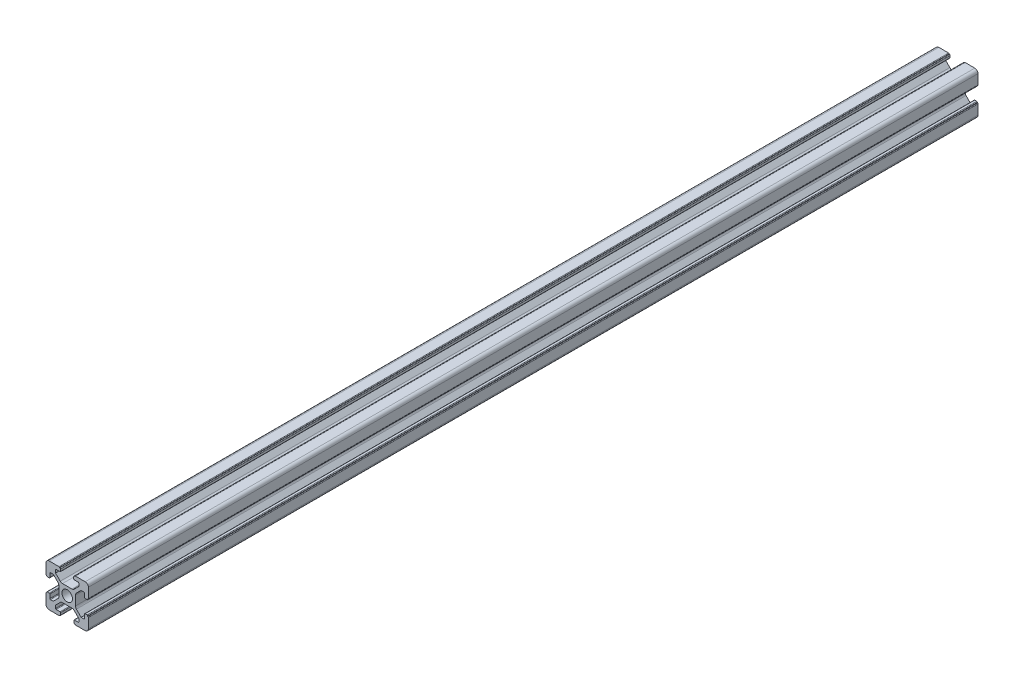
from build123d import *

# Parameters (mm, degrees)
BOSS_EXTRUDE1_DEPTH = 420
F_3DSKETCH2_R       = 2.5
CUT_EXTRUDE1_DEPTH  = 421.238108785


with BuildPart() as part:
    # Sketch1 → Boss-Extrude1 (new body)
    with BuildSketch(Plane.XY):
        with BuildLine():
            ThreePointArc((-4.339541497, 3.27832502), (-4.01438237, 2.791689997), (-3.900201668, 2.217664848))
            Line((-3.900201668, 2.217664848), (-3.900201668, -2.220777458))
            ThreePointArc((-3.900201668, -2.220777458), (-4.013982246, -2.793835668), (-4.338062619, -3.279956687))
            ThreePointArc((-4.338062619, -3.279956687), (-4.338801799, -3.280697416), (-4.339541497, -3.28143763))
            Line((-4.339541497, -3.28143763), (-6.559305445, -5.501201578))
            Line((-6.559305445, -5.501201578), (-7.918645273, -5.501201578))
            ThreePointArc((-7.918645273, -5.501201578), (-8.116635172, -5.419191476), (-8.198645273, -5.221201578))
            Line((-8.198645273, -5.221201578), (-8.198645273, -3.381201578))
            ThreePointArc((-8.198645273, -3.381201578), (-8.280655374, -3.183211679), (-8.478645273, -3.101201578))
            Line((-8.478645273, -3.101201578), (-9.418645273, -3.101201578))
            ThreePointArc((-9.418645273, -3.101201578), (-9.616635172, -3.183211679), (-9.698645273, -3.381201578))
            Line((-9.698645273, -3.381201578), (-9.698645273, -3.601201578))
            Line((-9.698645273, -3.601201578), (-9.718645273, -3.601201578))
            ThreePointArc((-9.718645273, -3.601201578), (-9.916635172, -3.683211679), (-9.998645273, -3.881201578))
            Line((-9.998645273, -3.881201578), (-9.998645273, -8.501201578))
            ThreePointArc((-9.998645273, -8.501201578), (-9.559305445, -9.561861749), (-8.498645273, -10.001201578))
            Line((-8.498645273, -10.001201578), (-3.878645273, -10.001201578))
            ThreePointArc((-3.878645273, -10.001201578), (-3.680655374, -9.919191476), (-3.598645273, -9.721201578))
            Line((-3.598645273, -9.721201578), (-3.598645273, -9.701201578))
            Line((-3.598645273, -9.701201578), (-3.378645273, -9.701201578))
            ThreePointArc((-3.378645273, -9.701201578), (-3.180655374, -9.619191476), (-3.098645273, -9.421201578))
            Line((-3.098645273, -9.421201578), (-3.098645273, -8.481201578))
            ThreePointArc((-3.098645273, -8.481201578), (-3.180655374, -8.283211679), (-3.378645273, -8.201201578))
            Line((-3.378645273, -8.201201578), (-5.218645273, -8.201201578))
            ThreePointArc((-5.218645273, -8.201201578), (-5.416635172, -8.119191476), (-5.498645273, -7.921201578))
            Line((-5.498645273, -7.921201578), (-5.498645273, -6.561861749))
            Line((-5.498645273, -6.561861749), (-3.277324929, -4.340541406))
            ThreePointArc((-3.277324929, -4.340541406), (-2.790689906, -4.015382279), (-2.216664757, -3.901201578))
            Line((-2.216664757, -3.901201578), (2.234977304, -3.899793498))
            ThreePointArc((2.234977304, -3.899793498), (2.801097117, -4.016727825), (3.280957809, -4.339061494))
            Line((3.280957809, -4.339061494), (5.502201668, -6.560305354))
            Line((5.502201668, -6.560305354), (5.502201668, -7.919645182))
            ThreePointArc((5.502201668, -7.919645182), (5.420191567, -8.117635081), (5.222201668, -8.199645182))
            Line((5.222201668, -8.199645182), (3.382201668, -8.199645182))
            ThreePointArc((3.382201668, -8.199645182), (3.18421177, -8.281655283), (3.102201668, -8.479645182))
            Line((3.102201668, -8.479645182), (3.102201668, -9.419645182))
            ThreePointArc((3.102201668, -9.419645182), (3.18421177, -9.617635081), (3.382201668, -9.699645182))
            Line((3.382201668, -9.699645182), (3.602201668, -9.699645182))
            Line((3.602201668, -9.699645182), (3.602201668, -9.719645182))
            ThreePointArc((3.602201668, -9.719645182), (3.68421177, -9.917635081), (3.882201668, -9.999645182))
            Line((3.882201668, -9.999645182), (8.502201668, -9.999645182))
            ThreePointArc((8.502201668, -9.999645182), (9.56286184, -9.560305354), (10.002201668, -8.499645182))
            Line((10.002201668, -8.499645182), (10.002201668, -3.879645182))
            ThreePointArc((10.002201668, -3.879645182), (9.920191567, -3.681655283), (9.722201668, -3.599645182))
            Line((9.722201668, -3.599645182), (9.702201668, -3.599645182))
            Line((9.702201668, -3.599645182), (9.702201668, -3.379645182))
            ThreePointArc((9.702201668, -3.379645182), (9.620191567, -3.181655283), (9.422201668, -3.099645182))
            Line((9.422201668, -3.099645182), (8.482201668, -3.099645182))
            ThreePointArc((8.482201668, -3.099645182), (8.28421177, -3.181655283), (8.202201668, -3.379645182))
            Line((8.202201668, -3.379645182), (8.202201668, -5.219645182))
            ThreePointArc((8.202201668, -5.219645182), (8.120191567, -5.417635081), (7.922201668, -5.499645182))
            Line((7.922201668, -5.499645182), (6.56286184, -5.499645182))
            Line((6.56286184, -5.499645182), (4.341541497, -3.278324838))
            ThreePointArc((4.341541497, -3.278324838), (4.01638237, -2.791689815), (3.902201668, -2.217664667))
            Line((3.902201668, -2.217664667), (3.900793589, 2.233977395))
            ThreePointArc((3.900793589, 2.233977395), (4.017727916, 2.800097207), (4.340061585, 3.2799579))
            Line((4.340061585, 3.2799579), (6.561305445, 5.501201759))
            Line((6.561305445, 5.501201759), (7.920645273, 5.501201759))
            ThreePointArc((7.920645273, 5.501201759), (8.118635172, 5.419191658), (8.200645273, 5.221201759))
            Line((8.200645273, 5.221201759), (8.200645273, 3.381201759))
            ThreePointArc((8.200645273, 3.381201759), (8.282655374, 3.183211861), (8.480645273, 3.101201759))
            Line((8.480645273, 3.101201759), (9.420645273, 3.101201759))
            ThreePointArc((9.420645273, 3.101201759), (9.618635172, 3.183211861), (9.700645273, 3.381201759))
            Line((9.700645273, 3.381201759), (9.700645273, 3.601201759))
            Line((9.700645273, 3.601201759), (9.720645273, 3.601201759))
            ThreePointArc((9.720645273, 3.601201759), (9.918635172, 3.683211861), (10.000645273, 3.881201759))
            Line((10.000645273, 3.881201759), (10.000645273, 8.501201759))
            ThreePointArc((10.000645273, 8.501201759), (9.561305445, 9.561861931), (8.500645273, 10.001201759))
            Line((8.500645273, 10.001201759), (3.880645273, 10.001201759))
            ThreePointArc((3.880645273, 10.001201759), (3.682655374, 9.919191658), (3.600645273, 9.721201759))
            Line((3.600645273, 9.721201759), (3.600645273, 9.701201759))
            Line((3.600645273, 9.701201759), (3.380645273, 9.701201759))
            ThreePointArc((3.380645273, 9.701201759), (3.182655374, 9.619191658), (3.100645273, 9.421201759))
            Line((3.100645273, 9.421201759), (3.100645273, 8.481201759))
            ThreePointArc((3.100645273, 8.481201759), (3.182655374, 8.283211861), (3.380645273, 8.201201759))
            Line((3.380645273, 8.201201759), (5.220645273, 8.201201759))
            ThreePointArc((5.220645273, 8.201201759), (5.418635172, 8.119191658), (5.500645273, 7.921201759))
            Line((5.500645273, 7.921201759), (5.500645273, 6.561861931))
            Line((5.500645273, 6.561861931), (3.279324929, 4.340541588))
            ThreePointArc((3.279324929, 4.340541588), (2.792689906, 4.015382461), (2.218664757, 3.901201759))
            Line((2.218664757, 3.901201759), (-2.232977304, 3.89979368))
            ThreePointArc((-2.232977304, 3.89979368), (-2.799097117, 4.016728006), (-3.278957809, 4.339061676))
            Line((-3.278957809, 4.339061676), (-5.500201668, 6.560305535))
            Line((-5.500201668, 6.560305535), (-5.500201668, 7.919645364))
            ThreePointArc((-5.500201668, 7.919645364), (-5.418191567, 8.117635262), (-5.220201668, 8.199645364))
            Line((-5.220201668, 8.199645364), (-3.380201668, 8.199645364))
            ThreePointArc((-3.380201668, 8.199645364), (-3.18221177, 8.281655465), (-3.100201668, 8.479645364))
            Line((-3.100201668, 8.479645364), (-3.100201668, 9.419645364))
            ThreePointArc((-3.100201668, 9.419645364), (-3.18221177, 9.617635262), (-3.380201668, 9.699645364))
            Line((-3.380201668, 9.699645364), (-3.600201668, 9.699645364))
            Line((-3.600201668, 9.699645364), (-3.600201668, 9.719645364))
            ThreePointArc((-3.600201668, 9.719645364), (-3.68221177, 9.917635262), (-3.880201668, 9.999645364))
            Line((-3.880201668, 9.999645364), (-8.500201668, 9.999645364))
            ThreePointArc((-8.500201668, 9.999645364), (-9.56086184, 9.560305535), (-10.000201668, 8.499645364))
            Line((-10.000201668, 8.499645364), (-10.000201668, 3.879645364))
            ThreePointArc((-10.000201668, 3.879645364), (-9.918191567, 3.681655465), (-9.720201668, 3.599645364))
            Line((-9.720201668, 3.599645364), (-9.700201668, 3.599645364))
            Line((-9.700201668, 3.599645364), (-9.700201668, 3.379645364))
            ThreePointArc((-9.700201668, 3.379645364), (-9.618191567, 3.181655465), (-9.420201668, 3.099645364))
            Line((-9.420201668, 3.099645364), (-8.480201668, 3.099645364))
            ThreePointArc((-8.480201668, 3.099645364), (-8.28221177, 3.181655465), (-8.200201668, 3.379645364))
            Line((-8.200201668, 3.379645364), (-8.200201668, 5.219645364))
            ThreePointArc((-8.200201668, 5.219645364), (-8.118191567, 5.417635262), (-7.920201668, 5.499645364))
            Line((-7.920201668, 5.499645364), (-6.56086184, 5.499645364))
            Line((-6.56086184, 5.499645364), (-4.339541497, 3.27832502))
        make_face()
    extrude(amount=BOSS_EXTRUDE1_DEPTH)

    # 3DSketch2 → Cut-Extrude1 (cut, through all)
    with BuildSketch(Plane.XY):
        Circle(F_3DSKETCH2_R)
    extrude(amount=CUT_EXTRUDE1_DEPTH, mode=Mode.SUBTRACT)


solid = part.part
